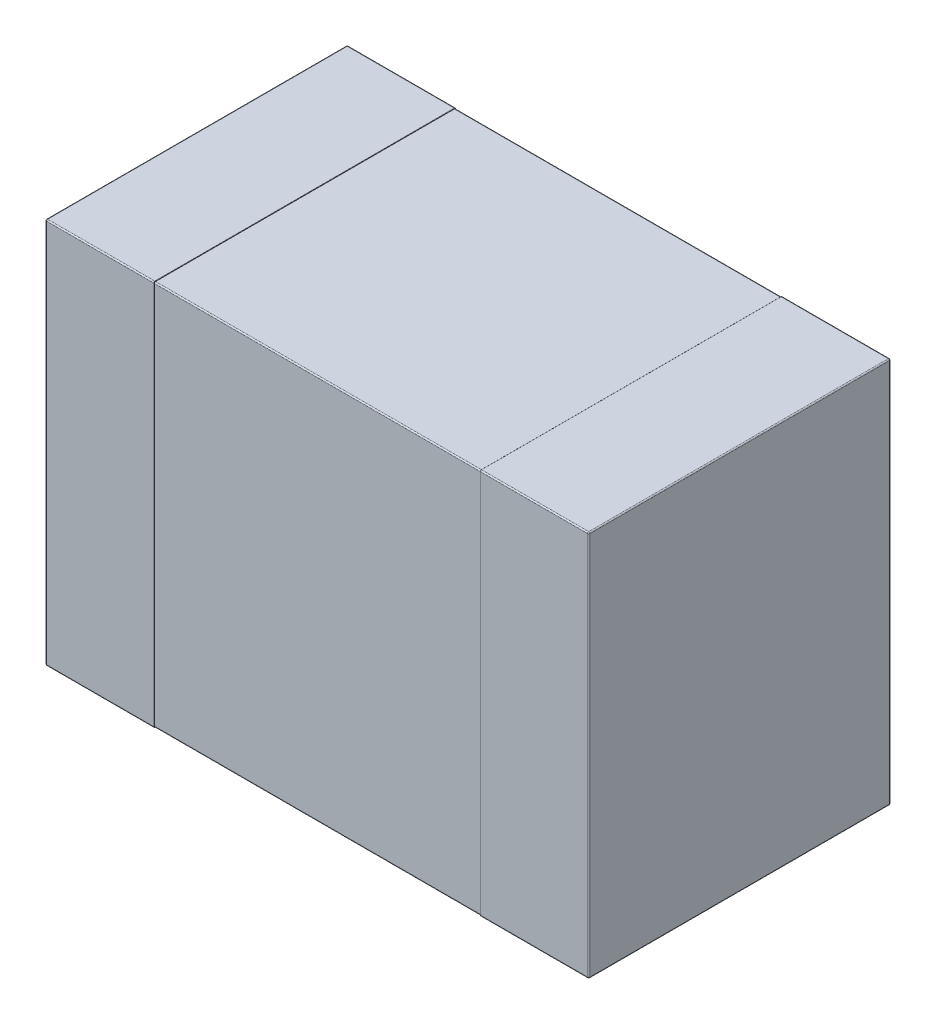
from build123d import *

# Parameters (mm, degrees)
SKETCH1_W                           = 4.5
SKETCH1_H                           = 3.2
ALL_BODY_DEPTH                      = 2.5
CUT_OUT_THE_BODY_FOR_PIN_DEPTH      = 1.35
CUT_OUT_THE_BODY_FOR_PIN_DEPTH_BACK = 1.35
SKETCH2_OUTSIDE_W                   = 5.712
SKETCH2_OUTSIDE_H                   = 6.412
SKETCH2_OUTSIDE_W_2                 = 2.494
SKETCH2_OUTSIDE_H_2                 = 3.194
BODY_FILLET_R                       = 0.01
PIN_FILLET_A_R                      = 0.01
PIN_FILLET_B_R                      = 0.003


with BuildPart() as part:
    # Sketch1 → All body (new body)
    with BuildSketch(Plane.XY):
        Rectangle(SKETCH1_W, SKETCH1_H)
    extrude(amount=ALL_BODY_DEPTH)

    # Sketch2 outside → Cut out the body for pin (cut, two sides: drawn at the far end of the back side and taken through both)
    with BuildSketch(Plane(origin=(0, 0, 0), x_dir=(0, 0, -1), z_dir=(1, 0, 0)).offset(-CUT_OUT_THE_BODY_FOR_PIN_DEPTH_BACK)):
        with Locations((-1.25, 0)):
            Rectangle(SKETCH2_OUTSIDE_W, SKETCH2_OUTSIDE_H)
        with Locations((-1.25, 0)):
            Rectangle(SKETCH2_OUTSIDE_W_2, SKETCH2_OUTSIDE_H_2, mode=Mode.SUBTRACT)
    extrude(amount=CUT_OUT_THE_BODY_FOR_PIN_DEPTH + CUT_OUT_THE_BODY_FOR_PIN_DEPTH_BACK, mode=Mode.SUBTRACT)

    # Body fillet
    body_fillet_edges = [part.edges().sort_by_distance(p)[0] for p in [
        (0, 1.597, 0.003),
        (0, 1.597, 2.497),
        (0, -1.597, 2.497),
        (0, -1.597, 0.003),
    ]]
    fillet(body_fillet_edges, radius=BODY_FILLET_R)

    # Pin fillet a
    pin_fillet_a_edges = [part.edges().sort_by_distance(p)[0] for p in [
        (2.25, 0, 2.5),
        (-1.8, 1.6, 0),
        (1.8, -1.6, 0),
        (1.8, -1.6, 2.5),
        (-1.8, 1.6, 2.5),
        (1.8, 1.6, 2.5),
        (-2.25, 0, 2.5),
        (1.8, 1.6, 0),
        (2.25, 0, 0),
        (-1.8, -1.6, 0),
        (-2.25, 0, 0),
        (-2.25, 1.6, 1.25),
        (2.25, 1.6, 1.25),
        (2.25, -1.6, 1.25),
        (-2.25, -1.6, 1.25),
        (-1.8, -1.6, 2.5),
    ]]
    fillet(pin_fillet_a_edges, radius=PIN_FILLET_A_R)

    # Pin fillet b
    pin_fillet_b_edges = [part.edges().sort_by_distance(p)[0] for p in [
        (1.35, -1.6, 1.25),
        (1.35, 0, 2.5),
        (1.35, 1.6, 1.25),
        (1.35, 0, 0),
        (-1.35, 1.6, 1.25),
        (-1.35, 0, 2.5),
        (-1.35, -1.6, 1.25),
        (-1.35, 0, 0),
        (1.35, 1.597071068, 0.002928932),
        (1.35, -1.597071068, 0.002928932),
        (1.35, -1.597071068, 2.497071068),
        (1.35, 1.597071068, 2.497071068),
        (-1.35, -1.597071068, 2.497071068),
        (-1.35, 1.597071068, 2.497071068),
        (-1.35, -1.597071068, 0.002928932),
        (-1.35, 1.597071068, 0.002928932),
    ]]
    fillet(pin_fillet_b_edges, radius=PIN_FILLET_B_R - 0.0001)  # a hair under: the kernel refuses the full size


solid = part.part
